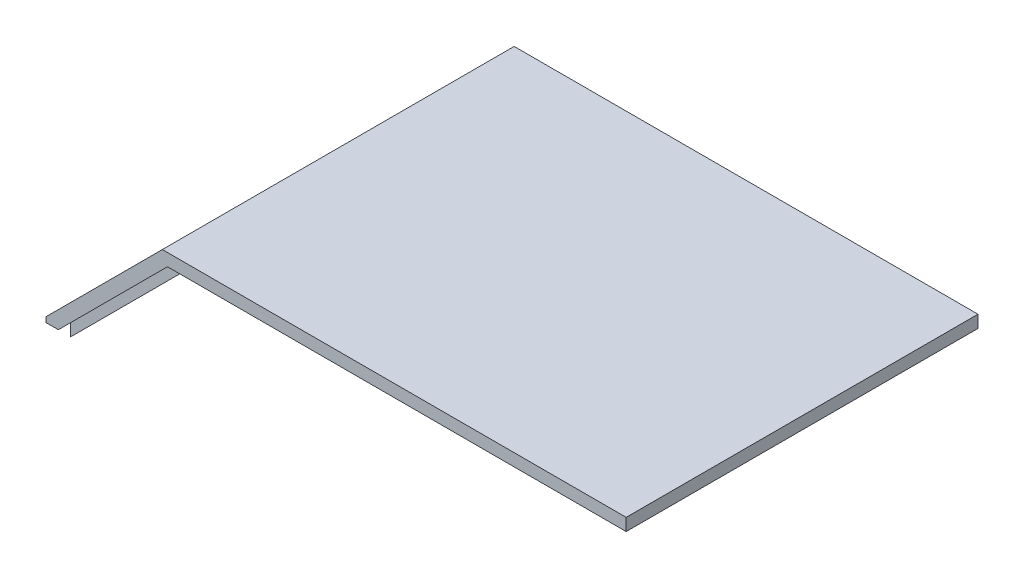
from build123d import *

# Parameters (mm, degrees)
BOSS_EXTRUDE1_DEPTH = 114
BOSS_EXTRUDE2_DEPTH = 4
BOSS_EXTRUDE3_DEPTH = 4


with BuildPart() as part:
    # Sketch1 → Boss-Extrude1 (new body)
    with BuildSketch(Plane.XY):
        Polygon((0, 0), (35.355339059, 35.355339059), (184, 35.355339059), (184, 39.355339059), (33.69848481, 39.355339059), (-4, 1.656854249), (-4, 0), align=None)
    extrude(amount=-BOSS_EXTRUDE1_DEPTH)

    # Sketch3 → Boss-Extrude2 (add)
    with BuildSketch(Plane.XZ.offset(-35.355339059)):
        Polygon((180, -4), (35.355339059, -4), (35.355339059, -6), (178, -6), (178, -108), (35.355339059, -108), (35.355339059, -110), (180, -110), align=None)
    extrude(amount=BOSS_EXTRUDE2_DEPTH)

    # Sketch5 → Boss-Extrude3 (add, along a direction that is not the sketch's normal)
    with BuildSketch(Plane(origin=(0, 0, 0), x_dir=(0, 0, -1), z_dir=(0.7071067811865488, -0.7071067811865464, 0))):
        Polygon((4, 50), (4, 0), (110, 0), (110, 50), (108, 50), (108, 3), (6, 3), (6, 50), align=None)
    extrude(amount=BOSS_EXTRUDE3_DEPTH, dir=(0, -1, 0))


solid = part.part
